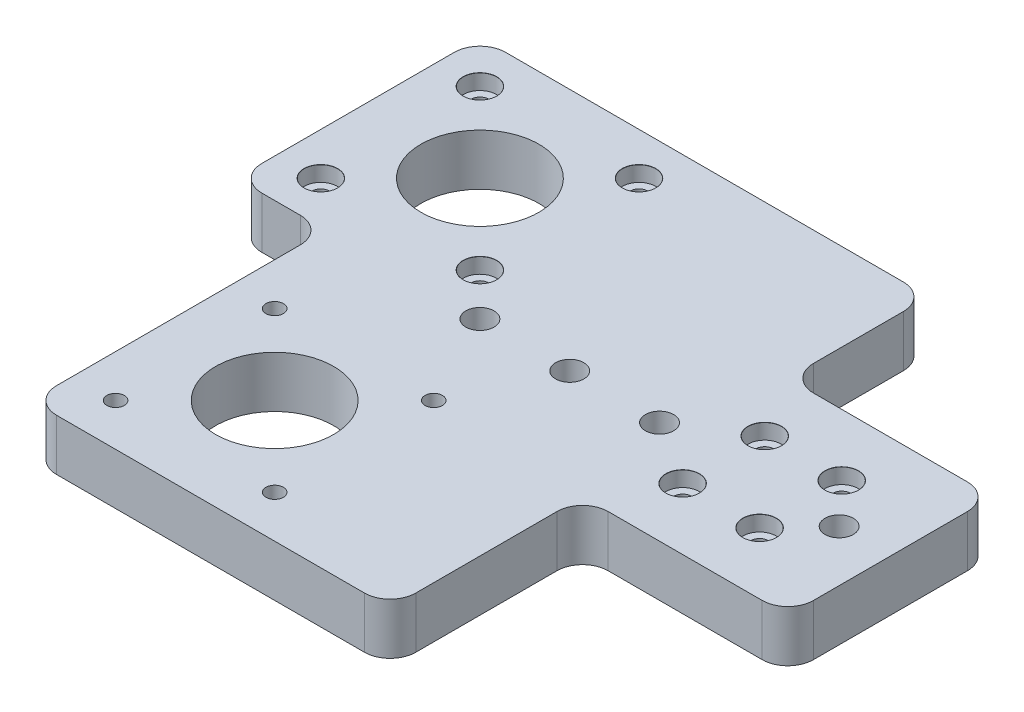
from build123d import *

# Parameters (mm, degrees)
BOSS_EXTRUDE1_DEPTH           = 10
FILLET1_R                     = 5
SKETCH3_R                     = 11.5
CUT_EXTRUDE1_DEPTH            = 10
CBORE_FOR_M3_SHCS1_AT_2_COUNT = 2
CBORE_FOR_M3_SHCS1_AT_2_PITCH = 43.840620434
CBORE_FOR_M3_SHCS1_AT_3_COUNT = 2
CBORE_FOR_M3_SHCS1_AT_3_PITCH = 31
CBORE_FOR_M3_SHCS1_AT_4_COUNT = 2
CBORE_FOR_M3_SHCS1_AT_4_PITCH = 31
CBORE_FOR_M3_SHCS2_AT_2_COUNT = 2
CBORE_FOR_M3_SHCS2_AT_2_PITCH = 15
CBORE_FOR_M3_SHCS2_AT_3_COUNT = 2
CBORE_FOR_M3_SHCS2_AT_3_PITCH = 21.931712199
CBORE_FOR_M3_SHCS2_AT_4_COUNT = 2
CBORE_FOR_M3_SHCS2_AT_4_PITCH = 16
CBORE_FOR_M5_SHCS1_AT_2_COUNT = 2
CBORE_FOR_M5_SHCS1_AT_2_PITCH = 35
CBORE_FOR_M5_SHCS1_AT_3_COUNT = 2
CBORE_FOR_M5_SHCS1_AT_3_PITCH = 52.5
CBORE_FOR_M5_SHCS1_AT_4_COUNT = 2
CBORE_FOR_M5_SHCS1_AT_4_PITCH = 70
BOSS_EXTRUDE2_DEPTH           = 10
CUT_EXTRUDE2_DEPTH            = 10
FILLET2_R                     = 5
SKETCH16_R                    = 11.5
CUT_EXTRUDE3_DEPTH            = 125.524094054
CBORE_FOR_M3_SHCS3_AT_2_COUNT = 2
CBORE_FOR_M3_SHCS3_AT_2_PITCH = 31
CBORE_FOR_M3_SHCS3_AT_3_COUNT = 2
CBORE_FOR_M3_SHCS3_AT_3_PITCH = 43.840620434
CBORE_FOR_M3_SHCS3_AT_4_COUNT = 2
CBORE_FOR_M3_SHCS3_AT_4_PITCH = 31


with BuildPart() as part:
    # Sketch1 → Boss-Extrude1 (new body)
    with BuildSketch(Plane(origin=(0, 0, 0), x_dir=(1, 0, 0), z_dir=(0, 1, 0))):
        Polygon((0, 67.5), (0, -47.5), (70, -47.5), (70, -10), (110, -10), (110, 30), (70, 30), (70, 67.5), align=None)
    extrude(amount=BOSS_EXTRUDE1_DEPTH)

    # Fillet1
    fillet1_edges = [part.edges().sort_by_distance(p)[0] for p in [
        (70, 5, -30),
        (110, 5, -30),
        (110, 5, 10),
        (70, 5, 10),
        (0, 5, 47.5),
        (0, 5, -67.5),
        (70, 5, -67.5),
        (70, 5, 47.5),
    ]]
    fillet(fillet1_edges, radius=FILLET1_R)

    # Sketch3 → Cut-Extrude1 (cut)
    with BuildSketch(Plane(origin=(0, 10, 0), x_dir=(1, 0, 0), z_dir=(0, 1, 0))):
        with Locations((23.75, -23.75)):
            Circle(SKETCH3_R)
    extrude(amount=-CUT_EXTRUDE1_DEPTH, mode=Mode.SUBTRACT)

    # Sketch6 → CBORE for M3 SHCS1 (revolve, cut)
    with BuildSketch(Plane(origin=(39.25, 0, 8.25), x_dir=(0, 0, -1), z_dir=(1, 0, 0))):
        Polygon((0, 0), (0, 10), (1.7, 10), (1.7, 3), (3.25, 3), (3.25, 0.025), (3.275, 0), align=None)
    cbore_for_m3_shcs1 = revolve(axis=Axis((39.25, -6.35, 8.25), (0, 1, 0)), mode=Mode.SUBTRACT)

    # CBORE for M3 SHCS1 at 2: CBORE for M3 SHCS1 ×2
    with Locations(*[Vector(-0.7071067811865478, 0, 0.7071067811865474) * (i * CBORE_FOR_M3_SHCS1_AT_2_PITCH) for i in range(1, CBORE_FOR_M3_SHCS1_AT_2_COUNT)]):
        add(cbore_for_m3_shcs1, mode=Mode.SUBTRACT)

    # CBORE for M3 SHCS1 at 3: CBORE for M3 SHCS1 ×2
    with Locations(*[(-i * CBORE_FOR_M3_SHCS1_AT_3_PITCH, 0, 0) for i in range(1, CBORE_FOR_M3_SHCS1_AT_3_COUNT)]):
        add(cbore_for_m3_shcs1, mode=Mode.SUBTRACT)

    # CBORE for M3 SHCS1 at 4: CBORE for M3 SHCS1 ×2
    with Locations(*[(0, 0, i * CBORE_FOR_M3_SHCS1_AT_4_PITCH) for i in range(1, CBORE_FOR_M3_SHCS1_AT_4_COUNT)]):
        add(cbore_for_m3_shcs1, mode=Mode.SUBTRACT)

    # Sketch9 → CBORE for M3 SHCS2 (revolve, cut)
    with BuildSketch(Plane(origin=(77.5, 10, -18), x_dir=(0, 0, 1), z_dir=(1, 0, 0))):
        Polygon((0, 0), (0, 10), (1.7, 10), (1.7, 3), (3.25, 3), (3.25, 0.025), (3.275, 0), align=None)
    cbore_for_m3_shcs2 = revolve(axis=Axis((77.5, 16.35, -18), (0, -1, 0)), mode=Mode.SUBTRACT)

    # CBORE for M3 SHCS2 at 2: CBORE for M3 SHCS2 ×2
    with Locations(*[(i * CBORE_FOR_M3_SHCS2_AT_2_PITCH, 0, 0) for i in range(1, CBORE_FOR_M3_SHCS2_AT_2_COUNT)]):
        add(cbore_for_m3_shcs2, mode=Mode.SUBTRACT)

    # CBORE for M3 SHCS2 at 3: CBORE for M3 SHCS2 ×2
    with Locations(*[Vector(0.6839411288813299, 0, 0.729537204140085) * (i * CBORE_FOR_M3_SHCS2_AT_3_PITCH) for i in range(1, CBORE_FOR_M3_SHCS2_AT_3_COUNT)]):
        add(cbore_for_m3_shcs2, mode=Mode.SUBTRACT)

    # CBORE for M3 SHCS2 at 4: CBORE for M3 SHCS2 ×2
    with Locations(*[(0, 0, i * CBORE_FOR_M3_SHCS2_AT_4_PITCH) for i in range(1, CBORE_FOR_M3_SHCS2_AT_4_COUNT)]):
        add(cbore_for_m3_shcs2, mode=Mode.SUBTRACT)

    # Sketch12 → CBORE for M5 SHCS1 (revolve, cut)
    with BuildSketch(Plane(origin=(100, 0, -10), x_dir=(0, 0, -1), z_dir=(1, 0, 0))):
        Polygon((0, 0), (0, 10), (2.75, 10), (2.75, 5), (5, 5), (5, 0.025), (5.025, 0), align=None)
    cbore_for_m5_shcs1 = revolve(axis=Axis((100, -6.35, -10), (0, 1, 0)), mode=Mode.SUBTRACT)

    # CBORE for M5 SHCS1 at 2: CBORE for M5 SHCS1 ×2
    with Locations(*[(-i * CBORE_FOR_M5_SHCS1_AT_2_PITCH, 0, 0) for i in range(1, CBORE_FOR_M5_SHCS1_AT_2_COUNT)]):
        add(cbore_for_m5_shcs1, mode=Mode.SUBTRACT)

    # CBORE for M5 SHCS1 at 3: CBORE for M5 SHCS1 ×2
    with Locations(*[(-i * CBORE_FOR_M5_SHCS1_AT_3_PITCH, 0, 0) for i in range(1, CBORE_FOR_M5_SHCS1_AT_3_COUNT)]):
        add(cbore_for_m5_shcs1, mode=Mode.SUBTRACT)

    # CBORE for M5 SHCS1 at 4: CBORE for M5 SHCS1 ×2
    with Locations(*[(-i * CBORE_FOR_M5_SHCS1_AT_4_PITCH, 0, 0) for i in range(1, CBORE_FOR_M5_SHCS1_AT_4_COUNT)]):
        add(cbore_for_m5_shcs1, mode=Mode.SUBTRACT)

    # Sketch14 → Boss-Extrude2 (add)
    with BuildSketch(Plane(origin=(0, 10, 0), x_dir=(1, 0, 0), z_dir=(0, 1, 0))):
        with BuildLine():
            Line((0, 10), (-17.5, 10))
            Line((-17.5, 10), (-17.5, 67.5))
            Line((-17.5, 67.5), (5, 67.5))
            ThreePointArc((5, 67.5), (1.464466094, 66.035533906), (0, 62.5))
            Line((0, 62.5), (0, 10))
        make_face()
    extrude(amount=-BOSS_EXTRUDE2_DEPTH)

    # Sketch15 → Cut-Extrude2 (cut)
    with BuildSketch(Plane(origin=(0, 10, 0), x_dir=(1, 0, 0), z_dir=(0, 1, 0))):
        with BuildLine():
            Line((-17.5, 67.5), (65, 67.5))
            ThreePointArc((65, 67.5), (68.535533906, 66.035533906), (70, 62.5))
            Line((70, 62.5), (70, 57.5))
            Line((70, 57.5), (-17.5, 57.5))
            Line((-17.5, 57.5), (-17.5, 67.5))
        make_face()
    extrude(amount=-CUT_EXTRUDE2_DEPTH, mode=Mode.SUBTRACT)

    # Fillet2
    fillet2_edges = [part.edges().sort_by_distance(p)[0] for p in [
        (0, 5, -10),
        (70, 5, -57.5),
        (-17.5, 5, -57.5),
        (-17.5, 5, -10),
    ]]
    fillet(fillet2_edges, radius=FILLET2_R)

    # Sketch16 → Cut-Extrude3 (cut, through all)
    with BuildSketch(Plane(origin=(0, 10, 0), x_dir=(1, 0, 0), z_dir=(0, 1, 0))):
        with Locations((6.25, 33.75)):
            Circle(SKETCH16_R)
    extrude(amount=-CUT_EXTRUDE3_DEPTH, mode=Mode.SUBTRACT)

    # Sketch19 → CBORE for M3 SHCS3 (revolve, cut)
    with BuildSketch(Plane(origin=(-9.25, 10, -49.25), x_dir=(0, 0, 1), z_dir=(1, 0, 0))):
        Polygon((0, 0), (0, 10), (1.7, 10), (1.7, 3), (3.25, 3), (3.25, 0.025), (3.275, 0), align=None)
    cbore_for_m3_shcs3 = revolve(axis=Axis((-9.25, 16.35, -49.25), (0, -1, 0)), mode=Mode.SUBTRACT)

    # CBORE for M3 SHCS3 at 2: CBORE for M3 SHCS3 ×2
    with Locations(*[(i * CBORE_FOR_M3_SHCS3_AT_2_PITCH, 0, 0) for i in range(1, CBORE_FOR_M3_SHCS3_AT_2_COUNT)]):
        add(cbore_for_m3_shcs3, mode=Mode.SUBTRACT)

    # CBORE for M3 SHCS3 at 3: CBORE for M3 SHCS3 ×2
    with Locations(*[Vector(0.7071067811865476, 0, 0.7071067811865475) * (i * CBORE_FOR_M3_SHCS3_AT_3_PITCH) for i in range(1, CBORE_FOR_M3_SHCS3_AT_3_COUNT)]):
        add(cbore_for_m3_shcs3, mode=Mode.SUBTRACT)

    # CBORE for M3 SHCS3 at 4: CBORE for M3 SHCS3 ×2
    with Locations(*[(0, 0, i * CBORE_FOR_M3_SHCS3_AT_4_PITCH) for i in range(1, CBORE_FOR_M3_SHCS3_AT_4_COUNT)]):
        add(cbore_for_m3_shcs3, mode=Mode.SUBTRACT)


solid = part.part
